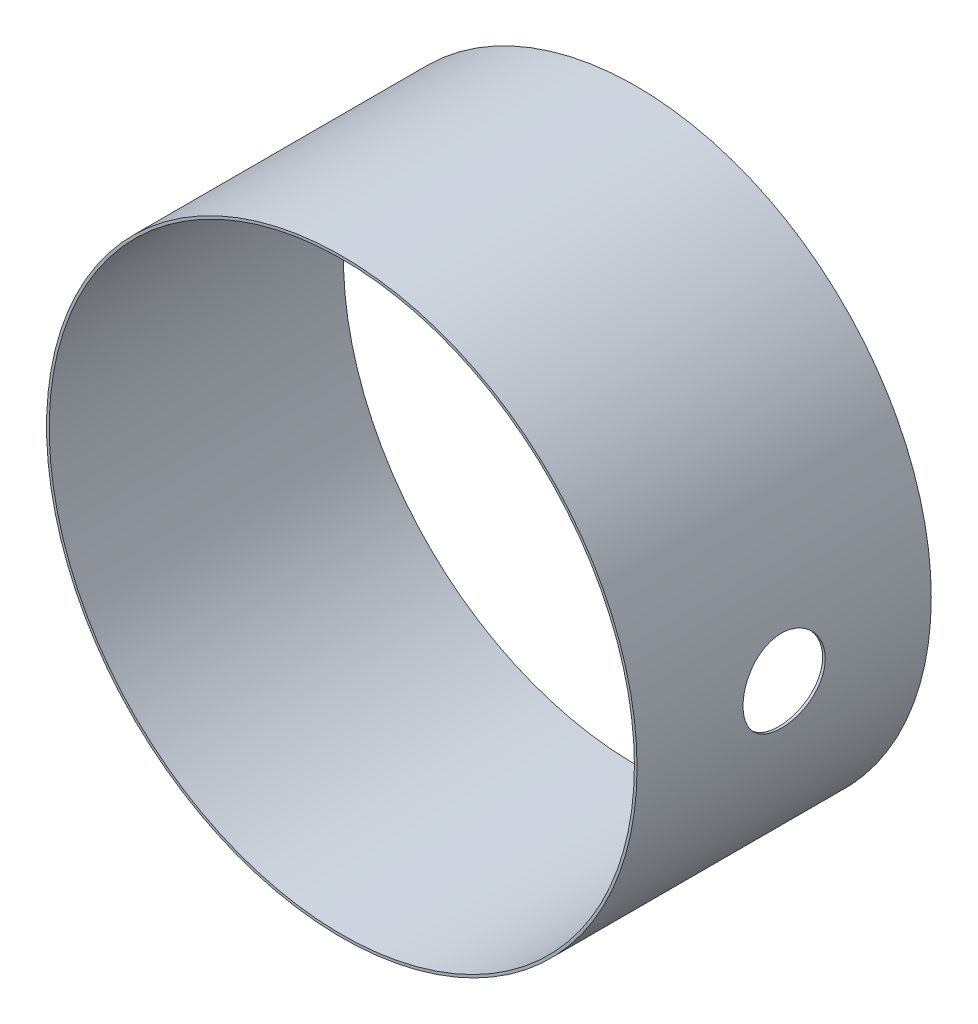
from build123d import *

# Parameters (mm, degrees)
SKETCH1_R           = 2007
SKETCH1_R_2         = 1989
BOSS_EXTRUDE1_DEPTH = 1000
SKETCH2_R           = 279.5
CUT_EXTRUDE1_DEPTH  = 3010.335142519


with BuildPart() as part:
    # Sketch1 → Boss-Extrude1 (new, symmetric)
    with BuildSketch(Plane.XY):
        Circle(SKETCH1_R)
        Circle(SKETCH1_R_2, mode=Mode.SUBTRACT)
    extrude(amount=BOSS_EXTRUDE1_DEPTH, both=True)

    # Sketch2 → Cut-Extrude1 (cut, through all)
    with BuildSketch(Plane(origin=(0, 0, 0), x_dir=(0, 0, -1), z_dir=(1, 0, 0))):
        Circle(SKETCH2_R)
    extrude(amount=CUT_EXTRUDE1_DEPTH, mode=Mode.SUBTRACT)


solid = part.part
